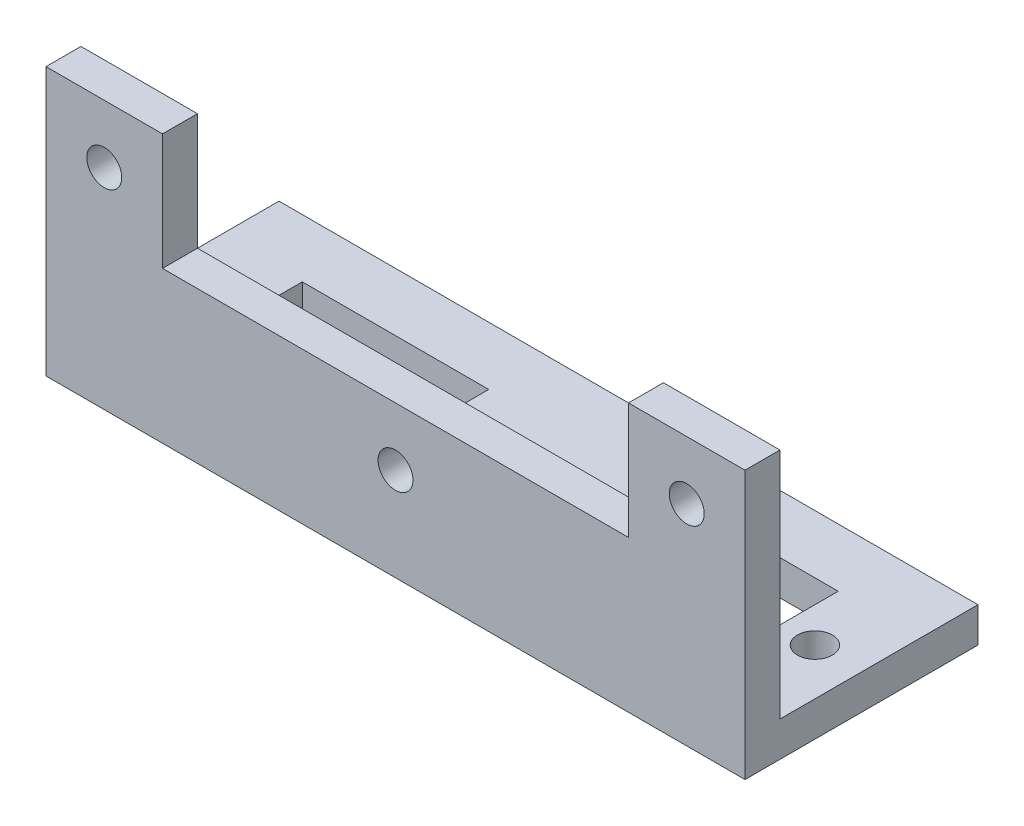
from build123d import *

# Parameters (mm, degrees)
SKETCH1_W           = 1524
SKETCH1_H           = 508
SKETCH1_W_2         = 406.4
SKETCH1_H_2         = 254
SKETCH1_R           = 38.1
BOSS_EXTRUDE2_DEPTH = 76.2
SCALE2_SCALE        = 0.039370079
SKETCH3_R           = 1.5
BOSS_EXTRUDE3_DEPTH = 3


with BuildPart() as part:
    # Sketch1 → Boss-Extrude2 (new body)
    with BuildSketch(Plane(origin=(0, 0, 0), x_dir=(1, 0, 0), z_dir=(0, 1, 0))):
        with Locations((584.2, 127)):
            Rectangle(SKETCH1_W, SKETCH1_H)
        with Locations((203.2, 127)):
            Rectangle(SKETCH1_W_2, SKETCH1_H_2, mode=Mode.SUBTRACT)
        with Locations((482.6, 127)):
            Circle(SKETCH1_R, mode=Mode.SUBTRACT)
        with Locations((685.8, 127)):
            Circle(SKETCH1_R, mode=Mode.SUBTRACT)
        with Locations((965.2, 127)):
            Rectangle(SKETCH1_W_2, SKETCH1_H_2, mode=Mode.SUBTRACT)
        with Locations((1244.6, 127)):
            Circle(SKETCH1_R, mode=Mode.SUBTRACT)
        with Locations((-76.2, 127)):
            Circle(SKETCH1_R, mode=Mode.SUBTRACT)
    extrude(amount=BOSS_EXTRUDE2_DEPTH)


with BuildPart() as part_1:
    # Scale2: scaled about (584.2, 38.1, -127)
    add(part.part.scale(SCALE2_SCALE).moved(Location((561.2, 36.6, -122))))

    # Sketch3 → Boss-Extrude3 (add)
    with BuildSketch(Plane.XY.offset(-117)):
        Polygon((604.2, 49.6), (564.2, 49.6), (564.2, 59.6), (559.2, 59.6), (554.2, 59.6), (554.2, 39.6), (584.2, 39.6), (614.2, 39.6), (614.2, 59.6), (609.2, 59.6), (604.2, 59.6), align=None)
        with Locations((584.2, 44.6)):
            Circle(SKETCH3_R, mode=Mode.SUBTRACT)
        with Locations((559.2, 54.6)):
            Circle(SKETCH3_R, mode=Mode.SUBTRACT)
        with Locations((609.2, 54.6)):
            Circle(SKETCH3_R, mode=Mode.SUBTRACT)
    extrude(amount=-BOSS_EXTRUDE3_DEPTH)


solid = part_1.part
